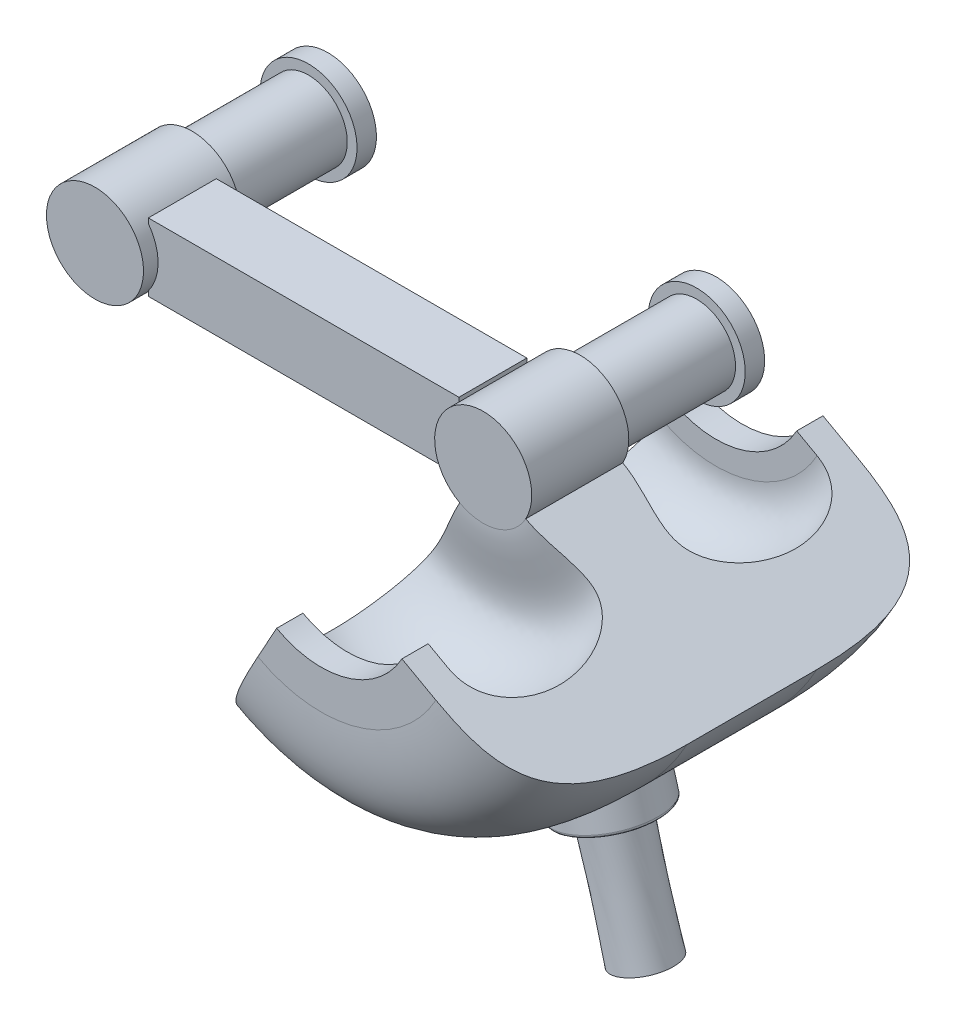
from build123d import *

# Parameters (mm, degrees)
SKETCH10_R          = 25
BOSS_EXTRUDE2_DEPTH = 25
REVOLVE3_ANGLE      = 90
SKETCH19_R          = 25
BOSS_EXTRUDE3_DEPTH = 50
FILLET6_R           = 1.5
SKETCH25_R          = 20
BOSS_EXTRUDE4_DEPTH = 60
BOSS_EXTRUDE5_START = 10
SKETCH26_R          = 25
BOSS_EXTRUDE5_DEPTH = 10
SKETCH27_R          = 20
BOSS_EXTRUDE6_DEPTH = 60
SKETCH28_R          = 25
BOSS_EXTRUDE7_DEPTH = 10


with BuildPart() as part:
    # Sketch3 → Revolve2 (revolve)
    with BuildSketch(Plane(origin=(0, 0, 0), x_dir=(1, 0, 0), z_dir=(0, 1, 0))):
        Polygon((-125, -32.53891123), (-125, 17.46108877), (-100, 17.46108877), (-100, 0), (-100, -15.07782246), (-100, -32.53891123), align=None)
    revolve(axis=Axis((-100, 0, 0), (0, 0, 1)))

    # Sketch6 → Loft2 section 0
    with BuildSketch(Plane(origin=(-80, 0, 0), x_dir=(0, 0, -1), z_dir=(1, 0, 0))):
        with BuildLine():
            Line((9.96108877, -17.5), (-25.03891123, -17.5))
            Line((-25.03891123, -17.5), (-25.03891123, 17.5))
            Line((-25.03891123, 17.5), (9.96108877, 17.5))
            Line((9.96108877, 17.5), (9.96108877, -17.5))
        make_face()
    # Sketch5 → Loft2 section 1
    with BuildSketch(Plane(origin=(80, 0, 0), x_dir=(0, 0, -1), z_dir=(1, 0, 0))):
        with BuildLine():
            Line((9.96108877, -17.5), (-25.03891123, -17.5))
            Line((-25.03891123, -17.5), (-25.03891123, 17.5))
            Line((-25.03891123, 17.5), (9.96108877, 17.5))
            Line((9.96108877, 17.5), (9.96108877, -17.5))
        make_face()
    loft()

    # Sketch10 → Boss-Extrude2 (add, symmetric)
    with BuildSketch(Plane.XY.offset(7.538911233)):
        with Locations((100, 0)):
            Circle(SKETCH10_R)
    extrude(amount=BOSS_EXTRUDE2_DEPTH, both=True)

    # Sketch13 → Revolve3 (revolve, symmetric)
    with BuildSketch(Plane(origin=(92.307490084, 26.647256571, 0), x_dir=(0, 0, -1), z_dir=(0.9607678704250572, 0.27735374372613175, 0))) as revolve3_sk:
        with BuildLine():
            Line((-41.003397863, -157.420055221), (25.925575398, -157.420055221))
            add(Edge.make_bspline(
                [(100.918479625, -95.235374373), (100.918479625, -103.819187393), (98.943583911, -138.760414592), (77.566461401, -157.420055221), (25.925575398, -157.420055221)],
                knots=[0, 0, 0, 0, 0.2175197, 1, 1, 1, 1], degree=3))
            Line((100.918479625, -95.235374373), (100.918479625, -75.235374373))
            Line((100.918479625, -75.235374373), (87.386654253, -75.235374373))
            Line((87.386654253, -75.235374373), (87.386654253, -87.235374373))
            add(Edge.make_bspline(
                [(17.461088767, -52.735374373), (17.461088767, -66.865072707), (2.602893469, -96.99328028), (54.696104455, -123.255260317), (87.386654253, -103.260979897), (87.386654253, -87.235374373)],
                knots=[0, 0, 0, 0, 0.304904739, 0.682398106, 1, 1, 1, 1], degree=3))
            Line((17.461088767, -52.735374373), (-32.538911233, -52.735374373))
            add(Edge.make_bspline(
                [(-32.538911233, -52.735374373), (-32.538911233, -66.865072707), (-17.680715934, -96.99328028), (-69.77392692, -123.255260317), (-102.464476718, -103.260979897), (-102.464476718, -87.235374373)],
                knots=[0, 0, 0, 0, 0.304904739, 0.682398106, 1, 1, 1, 1], degree=3))
            Line((-102.464476718, -87.235374373), (-102.464476718, -75.235374373))
            Line((-102.464476718, -75.235374373), (-115.99630209, -75.235374373))
            Line((-115.99630209, -75.235374373), (-115.99630209, -95.235374373))
            add(Edge.make_bspline(
                [(-115.99630209, -95.235374373), (-115.99630209, -103.819187393), (-114.021406376, -138.760414592), (-92.644283866, -157.420055221), (-41.003397863, -157.420055221)],
                knots=[0, 0, 0, 0, 0.2175197, 1, 1, 1, 1], degree=3))
        make_face()
    revolve(axis=Axis((100, 0, 32.538911233), (0, 0, -1)), revolution_arc=REVOLVE3_ANGLE / 2)
    revolve(revolve3_sk.sketch, axis=Axis((100, 0, 32.538911233), (0, 0, 1)), revolution_arc=REVOLVE3_ANGLE / 2)

    # Sketch19 → Boss-Extrude3 (add)
    with BuildSketch(Plane(origin=(35.427884289, -122.724043613, 0), x_dir=(-0.9607678704226367, -0.27735374373451605, 0), z_dir=(0.27735374373451605, -0.9607678704226368, 0))):
        with Locations((-96.076787042, -7.538911233)):
            Circle(SKETCH19_R)
    extrude(amount=BOSS_EXTRUDE3_DEPTH)

    # Loft4: read off the stored shape, not the designer's step
    # Loft4: loft between two sections, ruled curve by curve
    loft4_from = [
        Edge.make_bspline([(127.882970281, -148.075886157, 12.129325865), (119.062324499, -150.622223525, -16.431352943), (146.502507055, -142.700812334, -25.612182209), (155.323152838, -140.154474966, 2.9484966), (164.14379862, -137.608137599, 31.509175408), (136.703616063, -145.52954879, 40.690004674), (127.882970281, -148.075886157, 12.129325865)], [0, 0, 0, 0, 0.5, 0.5, 0.5, 1, 1, 1, 1], 3, [1, 0.333333333, 0.333333333, 1, 0.333333333, 0.333333333, 1]),
    ]
    loft4_to = [
        Edge.make_bspline([(148.940358563, -205.753913799, 18.677671161), (127.536833252, -211.932667332, -1.41491725), (146.841146631, -206.359912715, -23.692437107), (168.244671942, -200.181159182, -3.599848696), (189.648197253, -194.002405649, 16.492739715), (170.343883874, -199.575160266, 38.770259572), (148.940358563, -205.753913799, 18.677671161)], [0, 0, 0, 0, 0.5, 0.5, 0.5, 1, 1, 1, 1], 3, [1, 0.333333333, 0.333333333, 1, 0.333333333, 0.333333333, 1]),
    ]
    loft4 = Solid(Shell([*[Face.make_surface_from_curves(loft4_from[k], loft4_to[k]) for k in range(1)], Face(Wire(loft4_from)), Face(Wire(loft4_to))]))
    add(loft4)

    # Fillet6
    fillet6_edges = [part.edges().sort_by_distance(p)[0] for p in [
        (165.62225832, -137.181336969, 7.538911233),
        (155.323152838, -140.154474966, 2.9484966),
    ]]
    fillet(fillet6_edges, radius=FILLET6_R)

    # Sketch25 → Boss-Extrude4 (add)
    with BuildSketch(Plane(origin=(0, 0, -17.46108877), x_dir=(-1, 0, 0), z_dir=(0, 0, -1))):
        with Locations((100, 0)):
            Circle(SKETCH25_R)
    extrude(amount=BOSS_EXTRUDE4_DEPTH)

    # Sketch26 → Boss-Extrude5 (add)
    with BuildSketch(Plane(origin=(0, 0, -77.46108877), x_dir=(-1, 0, 0), z_dir=(0, 0, -1)).offset(BOSS_EXTRUDE5_START)):
        with Locations((100, 0)):
            Circle(SKETCH26_R)
    extrude(amount=-BOSS_EXTRUDE5_DEPTH)

    # Sketch27 → Boss-Extrude6 (add)
    with BuildSketch(Plane(origin=(0, 0, -17.461088767), x_dir=(-1, 0, 0), z_dir=(0, 0, -1))):
        with Locations(Location((-100, 0, 0), (0, 0, 180))):
            Circle(SKETCH27_R)
    extrude(amount=BOSS_EXTRUDE6_DEPTH)

    # Sketch28 → Boss-Extrude7 (add)
    with BuildSketch(Plane(origin=(0, 0, -77.461088767), x_dir=(-1, 0, 0), z_dir=(0, 0, -1))):
        with Locations((-100, 0)):
            Circle(SKETCH28_R)
    extrude(amount=BOSS_EXTRUDE7_DEPTH)


solid = part.part
